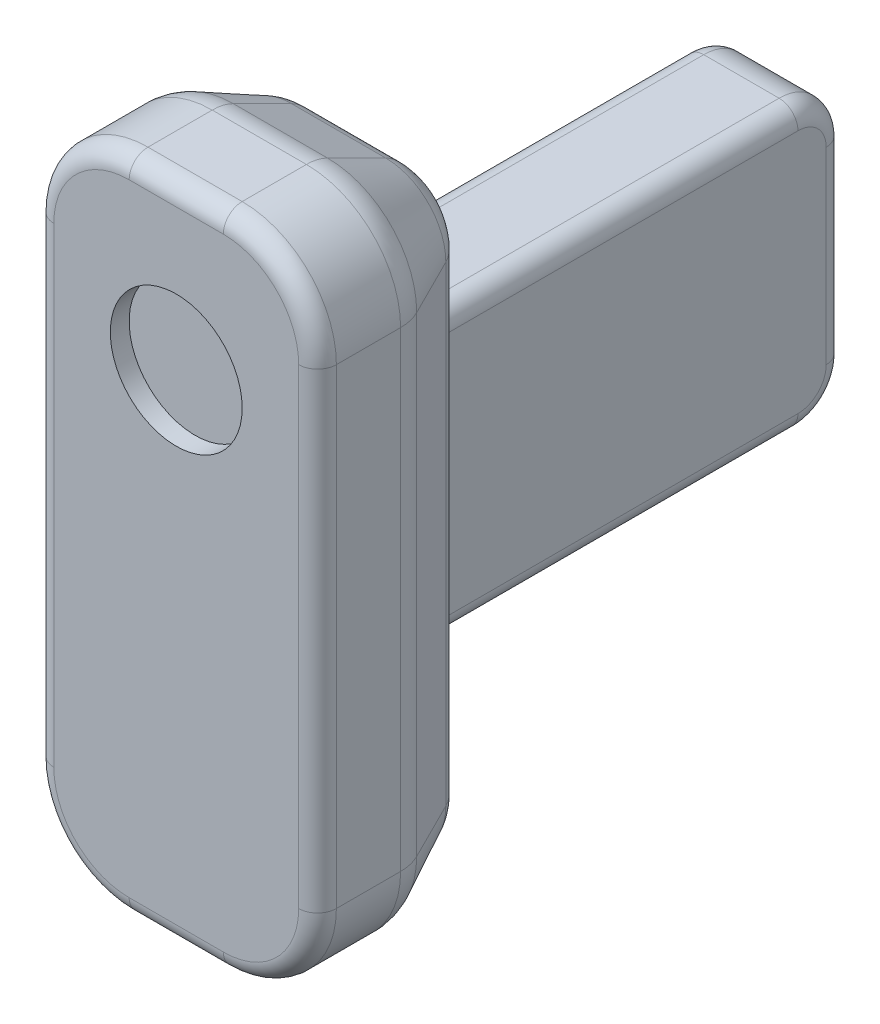
from build123d import *

# Parameters (mm, degrees)
SKETCH1_W           = 30
SKETCH1_H           = 70
BOSS_EXTRUDE1_DEPTH = 20
FILLET1_R           = 10
FILLET2_R           = 2
CHAMFER1_SIZE       = 5
CHAMFER1_SIZE2      = 10
FILLET3_R           = 5
SKETCH2_W           = 12
SKETCH2_H           = 30
BOSS_EXTRUDE2_DEPTH = 45
FILLET4_R           = 5
SKETCH3_R           = 7
CUT_EXTRUDE1_DEPTH  = 2
FILLET5_R           = 2


with BuildPart() as part:
    # Sketch1 → Boss-Extrude1 (new body)
    with BuildSketch(Plane.XY):
        with Locations((57.367254616, -81.313756287)):
            Rectangle(SKETCH1_W, SKETCH1_H)
    extrude(amount=-BOSS_EXTRUDE1_DEPTH)

    # Fillet1
    fillet1_edges = [part.edges().sort_by_distance(p)[0] for p in [
        (42.367254616, -46.313756287, -10),
        (72.367254616, -46.313756287, -10),
        (42.367254616, -116.313756287, -10),
        (72.367254616, -116.313756287, -10),
    ]]
    fillet(fillet1_edges, radius=FILLET1_R)

    # Fillet2
    fillet2_edges = [part.edges().sort_by_distance(p)[0] for p in [
        (69.438322428, -113.384824099, 0),
        (57.367254616, -116.313756287, 0),
        (45.296186805, -113.384824099, 0),
        (42.367254616, -81.313756287, 0),
        (45.296186805, -49.242688475, 0),
        (57.367254616, -46.313756287, 0),
        (69.438322428, -49.242688475, 0),
        (72.367254616, -81.313756287, 0),
    ]]
    fillet(fillet2_edges, radius=FILLET2_R)

    # Chamfer1
    chamfer1_edges = [part.edges().sort_by_distance(p)[0] for p in [
        (42.367254616, -81.313756287, -20),
        (45.296186805, -113.384824099, -20),
        (45.296186805, -49.242688475, -20),
        (57.367254616, -116.313756287, -20),
        (57.367254616, -46.313756287, -20),
        (69.438322428, -113.384824099, -20),
        (69.438322428, -49.242688475, -20),
        (72.367254616, -81.313756287, -20),
    ]]
    chamfer1_side = [part.faces().sort_by_distance(p)[0] for p in [
        (57.367254616, -81.313756287, -20),
    ]]
    chamfer(chamfer1_edges, length=CHAMFER1_SIZE, length2=CHAMFER1_SIZE2, reference=chamfer1_side[0])

    # Fillet3
    fillet3_edges = [part.edges().sort_by_distance(p)[0] for p in [
        (65.902788522, -52.778222381, -20),
        (57.367254616, -51.313756287, -20),
        (48.83172071, -52.778222381, -20),
        (47.367254616, -81.313756287, -20),
        (48.83172071, -109.849290193, -20),
        (57.367254616, -111.313756287, -20),
        (65.902788522, -109.849290193, -20),
        (69.438322428, -113.384824099, -10),
        (57.367254616, -116.313756287, -10),
        (45.296186805, -113.384824099, -10),
        (42.367254616, -81.313756287, -10),
        (45.296186805, -49.242688475, -10),
        (57.367254616, -46.313756287, -10),
        (69.438322428, -49.242688475, -10),
        (67.367254616, -81.313756287, -20),
        (72.367254616, -81.313756287, -10),
    ]]
    fillet(fillet3_edges, radius=FILLET3_R)

    # Sketch2 → Boss-Extrude2 (add)
    with BuildSketch(Plane(origin=(0, 0, -20), x_dir=(-1, 0, 0), z_dir=(0, 0, -1))):
        with Locations((-57.367254616, -81.313756287)):
            Rectangle(SKETCH2_W, SKETCH2_H)
    extrude(amount=BOSS_EXTRUDE2_DEPTH)

    # Fillet4
    fillet4_edges = [part.edges().sort_by_distance(p)[0] for p in [
        (57.367254616, -66.313756287, -65),
        (57.367254616, -96.313756287, -65),
    ]]
    fillet(fillet4_edges, radius=FILLET4_R)

    # Sketch3 → Cut-Extrude1 (cut)
    with BuildSketch(Plane.XY):
        with Locations((57.367254616, -63.313756287)):
            Circle(SKETCH3_R)
    extrude(amount=-CUT_EXTRUDE1_DEPTH, mode=Mode.SUBTRACT)

    # Fillet5
    fillet5_edges = [part.edges().sort_by_distance(p)[0] for p in [
        (51.367254616, -66.313756287, -40),
        (51.367254616, -67.778222381, -63.535533906),
        (51.367254616, -81.313756287, -65),
        (51.367254616, -94.849290193, -63.535533906),
        (63.367254616, -66.313756287, -40),
        (63.367254616, -67.778222381, -63.535533906),
        (63.367254616, -81.313756287, -65),
        (63.367254616, -94.849290193, -63.535533906),
        (51.367254616, -96.313756287, -40),
        (63.367254616, -96.313756287, -40),
    ]]
    fillet(fillet5_edges, radius=FILLET5_R)


solid = part.part
